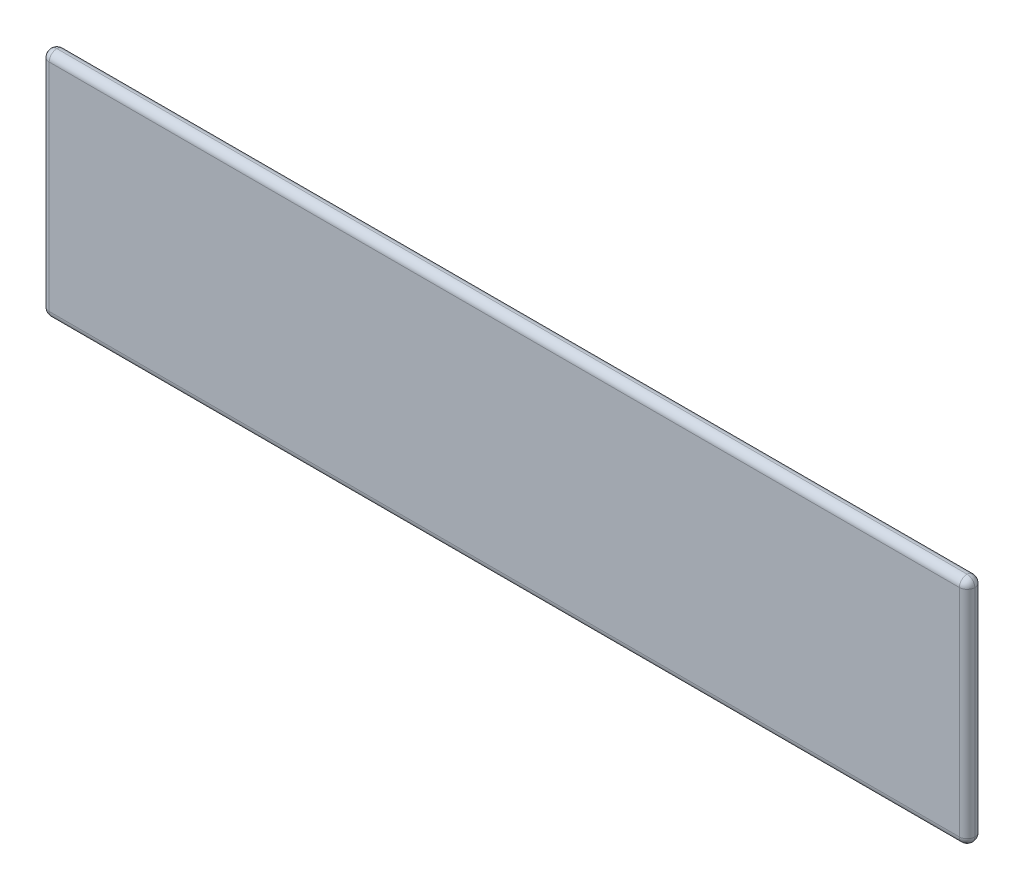
from build123d import *

# Parameters (mm, degrees)
SKETCH1_W           = 1200
SKETCH1_H           = 300
BOSS_EXTRUDE1_DEPTH = 10
FILLET1_R           = 10


with BuildPart() as part:
    # Sketch1 → Boss-Extrude1 (new, symmetric)
    with BuildSketch(Plane.XY):
        with Locations((600, -150)):
            Rectangle(SKETCH1_W, SKETCH1_H)
    extrude(amount=BOSS_EXTRUDE1_DEPTH, both=True)

    # Fillet1
    fillet1_edges = [part.edges().sort_by_distance(p)[0] for p in [
        (1200, -150, 10),
        (600, 0, 10),
        (0, -150, 10),
        (600, 0, -10),
        (1200, -150, -10),
        (600, -300, -10),
        (0, -150, -10),
        (0, 0, 0),
        (1200, 0, 0),
        (1200, -300, 0),
        (0, -300, 0),
        (600, -300, 10),
    ]]
    fillet(fillet1_edges, radius=FILLET1_R - 0.0001)  # a hair under: the kernel refuses the full size


solid = part.part
